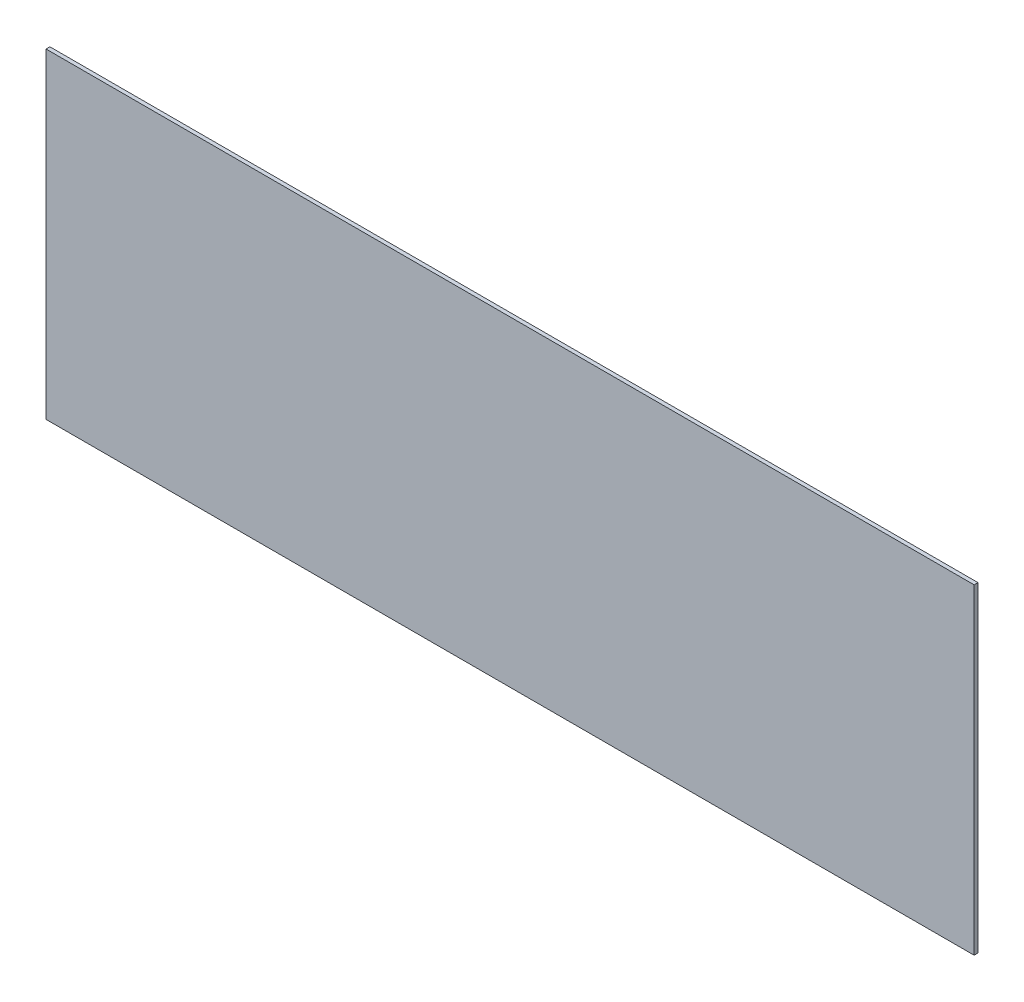
from build123d import *

# Parameters (mm, degrees)
SKETCH1_W           = 765
SKETCH1_H           = 264.4
BOSS_EXTRUDE1_DEPTH = 3.175


with BuildPart() as part:
    # Sketch1 → Boss-Extrude1 (new body)
    with BuildSketch(Plane.XY):
        Rectangle(SKETCH1_W, SKETCH1_H)
    extrude(amount=BOSS_EXTRUDE1_DEPTH)


solid = part.part
